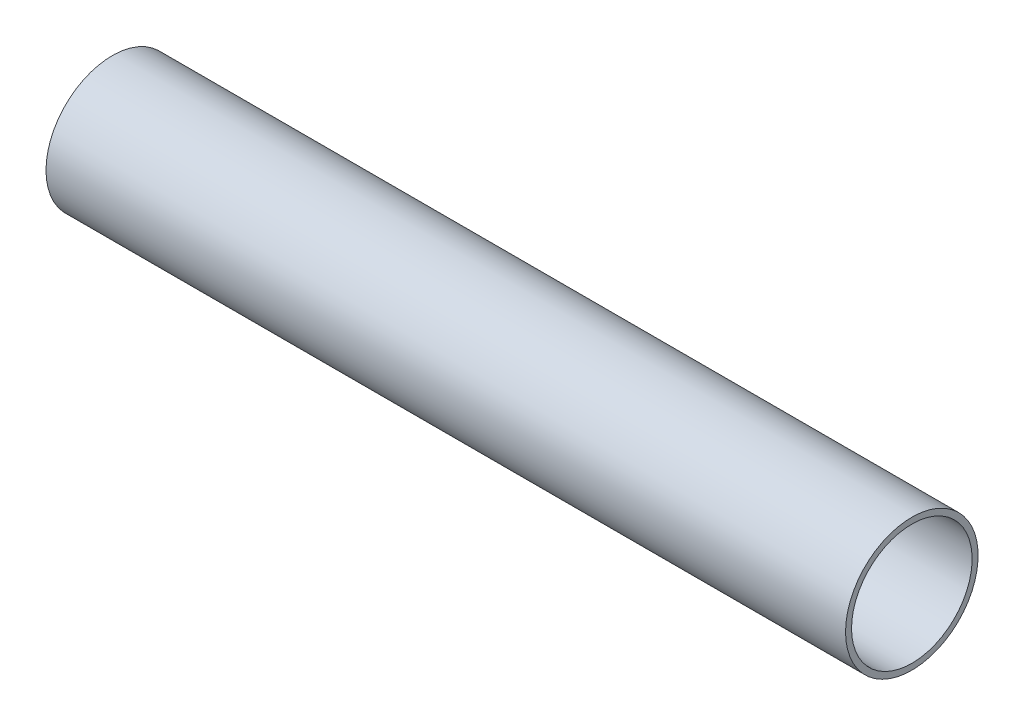
from build123d import *

# Parameters (mm, degrees)
SKETCH1_R           = 12.6365
SKETCH1_R_2         = 11.4935
BOSS_EXTRUDE1_DEPTH = 76.2


with BuildPart() as part:
    # Sketch1 → Boss-Extrude1 (new, symmetric)
    with BuildSketch(Plane(origin=(0, 0, 0), x_dir=(0, 0, -1), z_dir=(1, 0, 0))):
        Circle(SKETCH1_R)
        Circle(SKETCH1_R_2, mode=Mode.SUBTRACT)
    extrude(amount=BOSS_EXTRUDE1_DEPTH, both=True)


solid = part.part
